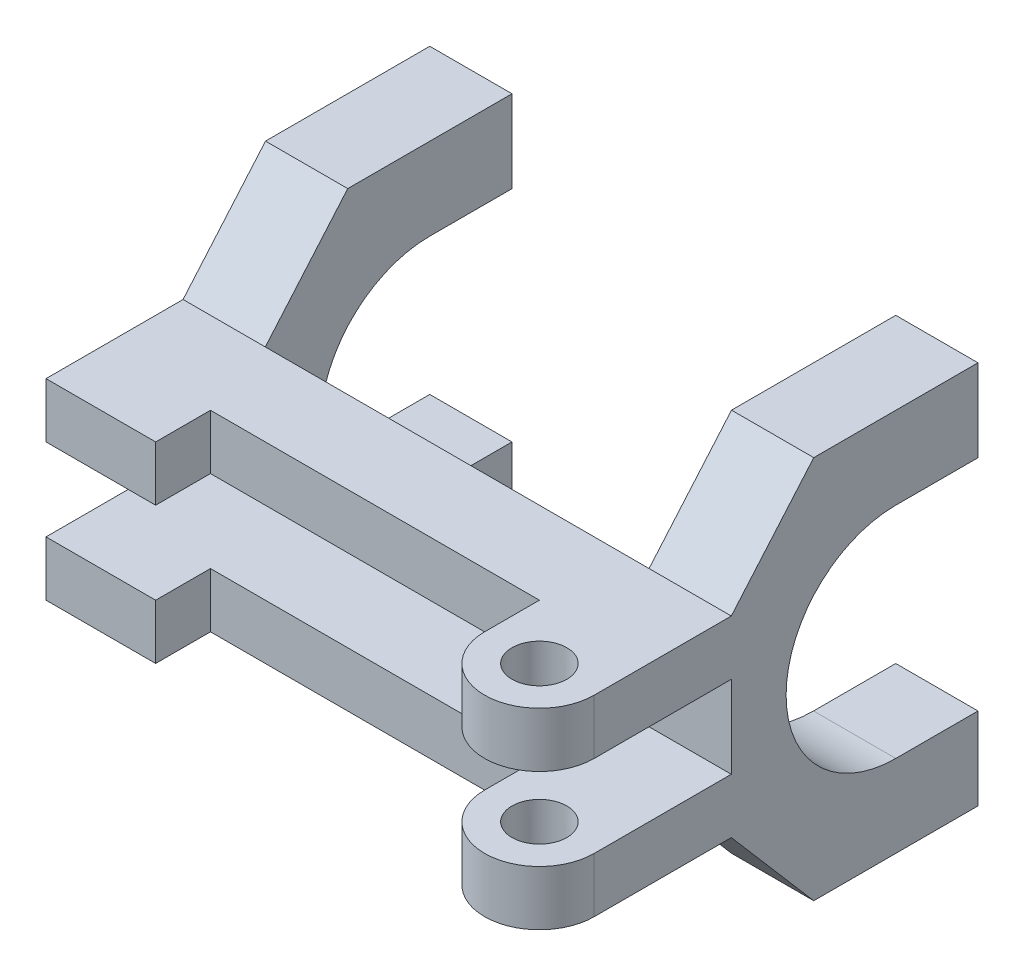
from build123d import *

# Parameters (mm, degrees)
BOSS_EXTRUDE1_DEPTH = 127
SKETCH2_R           = 6.35
CUT_EXTRUDE1_DEPTH  = 142.028625197
SKETCH4_W           = 88.9
SKETCH4_H           = 57.15
CUT_EXTRUDE2_DEPTH  = 147.187978302


with BuildPart() as part:
    # Sketch1 → Boss-Extrude1 (new body)
    with BuildSketch(Plane.YZ):
        with BuildLine():
            Line((12.7, 44.45), (0, 44.45))
            Line((0, 44.45), (0, 0))
            Line((0, 0), (-9.525, 0))
            Line((-9.525, 0), (-9.525, -12.7))
            ThreePointArc((-9.525, -12.7), (8.435512242, -20.139487758), (15.875, -38.1))
            Line((15.875, -38.1), (15.875, -57.15))
            Line((15.875, -57.15), (34.925, -57.15))
            Line((34.925, -57.15), (34.925, -19.098767483))
            Line((34.925, -19.098767483), (12.7, 0))
            Line((12.7, 0), (12.7, 44.45))
        make_face()
    extrude(amount=-BOSS_EXTRUDE1_DEPTH)

    # Sketch2 → Cut-Extrude1 (cut, through all)
    with BuildSketch(Plane(origin=(0, 12.7, 0), x_dir=(-1, 0, 0), z_dir=(0, 1, 0))):
        with BuildLine():
            ThreePointArc((0, 31.75), (3.719743898, 40.73025614), (12.700000053, 44.45))
            Line((12.700000053, 44.45), (0, 44.45))
            Line((0, 44.45), (0, 31.75))
        make_face()
        with BuildLine():
            Line((101.6, 31.75), (127, 31.75))
            Line((127, 31.75), (127, 44.45))
            Line((127, 44.45), (12.700000053, 44.45))
            ThreePointArc((12.700000053, 44.45), (21.68025614, 40.730256102), (25.4, 31.75))
            Line((25.4, 31.75), (25.4, 19.05))
            Line((25.4, 19.05), (101.6, 19.05))
            Line((101.6, 19.05), (101.6, 31.75))
        make_face()
        with Locations((12.7, 31.75)):
            Circle(SKETCH2_R)
    extrude(amount=-CUT_EXTRUDE1_DEPTH, mode=Mode.SUBTRACT)

    # Sketch4 → Cut-Extrude2 (cut, through all)
    with BuildSketch(Plane(origin=(0, 34.925, 0), x_dir=(-1, 0, 0), z_dir=(0, 1, 0))):
        with Locations((63.5, -28.575)):
            Rectangle(SKETCH4_W, SKETCH4_H)
    extrude(amount=-CUT_EXTRUDE2_DEPTH, mode=Mode.SUBTRACT)

    # Mirror1: part across plane


with BuildPart() as part_1:
    add(part.part)
    add(part.part.mirror(Plane(origin=(-127, -9.525, 0), x_dir=(0, 0, 1), z_dir=(0, -1, 0))))


solid = part_1.part
